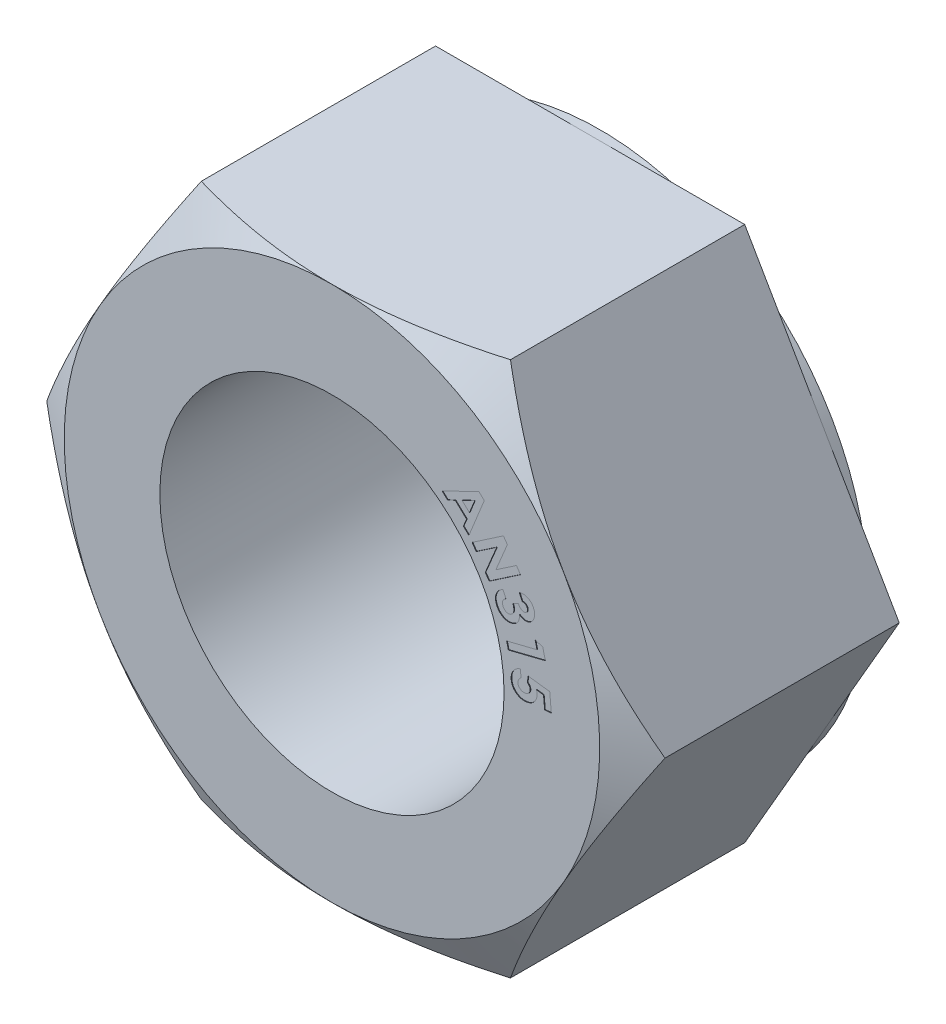
from build123d import *
from build123d.topology import SkipClean

# Parameters (mm, degrees)
SKETCH1_R           = 7.14375
BOSS_EXTRUDE1_DEPTH = 10.715625
SKETCH2_OUTSIDE_W   = 47.158
SKETCH2_OUTSIDE_H   = 43.72
SKETCH2_OUTSIDE_R   = 11.1125
CUT_EXTRUDE1_DEPTH  = 3.571875
CUT_EXTRUDE1_DRAFT  = -60
BOSS_EXTRUDE2_START = 0.4064
SKETCH3_R           = 11.1125
SKETCH3_R_2         = 7.14375
BOSS_EXTRUDE2_DEPTH = 0.4064
CUT_EXTRUDE2_DEPTH  = 0.0254


with BuildPart() as part:
    # Sketch1 → Boss-Extrude1 (new body)
    with BuildSketch(Plane.XY):
        Polygon((6.415804866, 11.1125), (-6.415804866, 11.1125), (-12.831609733, 0), (-6.415804866, -11.1125), (6.415804866, -11.1125), (12.831609733, 0), align=None)
        Circle(SKETCH1_R, mode=Mode.SUBTRACT)
    extrude(amount=BOSS_EXTRUDE1_DEPTH)


with BuildPart() as cut_extrude1_tool:
    # Sketch2 outside → Cut-Extrude1 (with draft: the straight prism first)
    with BuildSketch(Plane.XY.offset(10.715625)):
        Rectangle(SKETCH2_OUTSIDE_W, SKETCH2_OUTSIDE_H)
        Circle(SKETCH2_OUTSIDE_R, mode=Mode.SUBTRACT)
    extrude(amount=-CUT_EXTRUDE1_DEPTH)
    # Cut-Extrude1: the draft: its side faces are tilted about the plane it starts from
    cut_extrude1_sides = [cut_extrude1_tool.faces().sort_by_distance(p)[0] for p in [
        (0, -21.86, 8.9296875),
        (23.579, 0, 8.9296875),
        (0, 21.86, 8.9296875),
        (-23.579, 0, 8.9296875),
        (-11.1125, 0, 8.9296875),
    ]]
    draft(cut_extrude1_sides, Plane.XY.offset(10.715625), CUT_EXTRUDE1_DRAFT)


with BuildPart() as part_1:
    add(part.part)

    # Cut-Extrude1: cut by cut_extrude1_tool
    add(cut_extrude1_tool.part, mode=Mode.SUBTRACT)

    # Sketch3 → Boss-Extrude2 (add)
    with SkipClean():  # the faces are left unmerged after this step: merging them gives an invalid solid
        with BuildSketch(Plane(origin=(0, 0, 0), x_dir=(-1, 0, 0), z_dir=(0, 0, -1)).offset(BOSS_EXTRUDE2_START)):
            Circle(SKETCH3_R)
            Circle(SKETCH3_R_2, mode=Mode.SUBTRACT)
        extrude(amount=-BOSS_EXTRUDE2_DEPTH)

    # Sketch4 → Cut-Extrude2 (cut)
    # profile 1 of 5: a face of its own
    with SkipClean():  # the faces are left unmerged after this step: merging them gives an invalid solid
        with BuildSketch(Plane.XY.offset(10.715625)):
            with BuildLine():
                Line((9.038453282, 0.990915797), (9.105871151, 0.251227296))
                Line((9.105871151, 0.251227296), (8.828885474, 0.225786591))
                Line((8.828885474, 0.225786591), (8.781820169, 0.74096087))
                Line((8.781820169, 0.74096087), (8.488298034, 0.779439936))
                add(Edge.make_bspline(
                    [(8.488298034, 0.779439936), (8.491399544, 0.770788724), (8.497505412, 0.753757294), (8.504191357, 0.728055043), (8.510037954, 0.703214375), (8.511881599, 0.686713923), (8.512784712, 0.678631142)],
                    knots=[0, 0, 0, 0, 1.059698368, 2.086202335, 3.062522125, 4, 4, 4, 4], degree=3))
                add(Edge.make_bspline(
                    [(8.512784712, 0.678631142), (8.514012123, 0.661041097), (8.516422683, 0.62649529), (8.513499882, 0.575374368), (8.506700942, 0.526147598), (8.494918734, 0.478641893), (8.477845057, 0.43315961), (8.456590273, 0.389156371), (8.429846961, 0.347541902), (8.399270921, 0.307781278), (8.36426837, 0.271500572), (8.32648162, 0.238534295), (8.285485591, 0.209949812), (8.241243914, 0.18620183), (8.194364838, 0.166033227), (8.144452599, 0.150068298), (8.091500515, 0.13858384), (8.055005274, 0.134415938), (8.036407509, 0.132291999)],
                    knots=[0, 0, 0, 0, 1.041787241, 2.046008406, 3.021166164, 3.97746446, 4.933454527, 5.889444595, 6.861575472, 7.853394237, 8.850960893, 9.837536107, 10.814807103, 11.799368876, 12.801906058, 13.828801175, 14.893569587, 16, 16, 16, 16], degree=3))
                add(Edge.make_bspline(
                    [(8.036407509, 0.132291999), (8.017547874, 0.131118341), (7.98036187, 0.12880421), (7.925164511, 0.131000549), (7.87180188, 0.138673197), (7.820237245, 0.151471081), (7.770458207, 0.169320764), (7.722500985, 0.192342755), (7.676504506, 0.220641086), (7.632559948, 0.253327047), (7.592370611, 0.290447965), (7.55562871, 0.32978936), (7.524390977, 0.372400719), (7.497972249, 0.417462414), (7.475720767, 0.464839148), (7.458556444, 0.514936342), (7.446397404, 0.567732517), (7.442037004, 0.603952548), (7.439822974, 0.622343582)],
                    knots=[0, 0, 0, 0, 1.054162503, 2.078518009, 3.076689065, 4.058169131, 5.038775065, 6.023157371, 7.021591392, 8.048659839, 9.074637147, 10.071176272, 11.048582306, 12.016578309, 12.98267406, 13.964938398, 14.966679863, 16, 16, 16, 16], degree=3))
                add(Edge.make_bspline(
                    [(7.439822974, 0.622343582), (7.438732469, 0.638871826), (7.43658061, 0.671486512), (7.437589755, 0.719983741), (7.442258775, 0.767008108), (7.450889724, 0.812557489), (7.463428917, 0.856538015), (7.479227312, 0.89930419), (7.499088631, 0.940466093), (7.522534652, 0.979901833), (7.549693818, 1.016866603), (7.579095158, 1.051884443), (7.612273508, 1.083447964), (7.64807298, 1.112337824), (7.686892732, 1.138362892), (7.728772026, 1.161061253), (7.773220834, 1.181765636), (7.804574472, 1.192496162), (7.820479524, 1.197939535)],
                    knots=[0, 0, 0, 0, 1.059531475, 2.090741458, 3.099761619, 4.080197849, 5.052907682, 6.02303628, 6.993852298, 7.973326062, 8.954254897, 9.92613664, 10.895173845, 11.879286914, 12.866946685, 13.880879383, 14.925013941, 16, 16, 16, 16], degree=3))
                Line((7.820479524, 1.197939535), (7.849100317, 0.882474792))
                add(Edge.make_bspline(
                    [(7.849100317, 0.882474792), (7.837889272, 0.875103144), (7.816130753, 0.860796169), (7.78733142, 0.83551008), (7.764066003, 0.807121528), (7.7449852, 0.776907948), (7.731411089, 0.744589115), (7.722362836, 0.711126592), (7.718023757, 0.676503761), (7.719118025, 0.653196448), (7.71967073, 0.641424111)],
                    knots=[0, 0, 0, 0, 1.113311254, 2.160726529, 3.167065378, 4.15133894, 5.117501339, 6.065451714, 7.022875119, 8, 8, 8, 8], degree=3))
                add(Edge.make_bspline(
                    [(7.71967073, 0.641424111), (7.720693976, 0.633238888), (7.722703258, 0.617166086), (7.728115326, 0.593798754), (7.735821276, 0.57163626), (7.745767715, 0.550558973), (7.757714037, 0.530475809), (7.772347058, 0.511986992), (7.788626351, 0.494338107), (7.806869398, 0.477953102), (7.826884888, 0.463337116), (7.848158578, 0.450882829), (7.870610921, 0.441000572), (7.894077448, 0.43338672), (7.918500257, 0.427541816), (7.944092247, 0.424396757), (7.970705583, 0.423876391), (7.988710644, 0.424947676), (7.997928442, 0.425496126)],
                    knots=[0, 0, 0, 0, 1.005792376, 1.975010484, 2.919678592, 3.862575002, 4.813945469, 5.763204514, 6.733112457, 7.740399942, 8.74909744, 9.751559368, 10.741516783, 11.735183179, 12.757710372, 13.800237418, 14.873818355, 16, 16, 16, 16], degree=3))
                add(Edge.make_bspline(
                    [(7.997928442, 0.425496126), (8.006857984, 0.42650535), (8.024408142, 0.428488883), (8.049765968, 0.434073704), (8.073858714, 0.440828966), (8.096245418, 0.450256541), (8.117335791, 0.461402529), (8.137121922, 0.474407095), (8.15535108, 0.489545393), (8.172095101, 0.506240738), (8.18691396, 0.524298589), (8.19982629, 0.54301537), (8.209996679, 0.562769505), (8.218398857, 0.582907585), (8.223986496, 0.603906573), (8.228041201, 0.625355506), (8.22923402, 0.647579816), (8.228312615, 0.662523053), (8.227848815, 0.670044904)],
                    knots=[0, 0, 0, 0, 1.150546408, 2.261288592, 3.322783048, 4.351809269, 5.366394834, 6.375877368, 7.379220387, 8.397163563, 9.400506582, 10.368577705, 11.30409275, 12.242265653, 13.15825545, 14.082663711, 15.034886575, 16, 16, 16, 16], degree=3))
                add(Edge.make_bspline(
                    [(8.227848815, 0.670044904), (8.226770826, 0.678242315), (8.22461547, 0.694632412), (8.21781349, 0.718862891), (8.207478352, 0.742336504), (8.194268531, 0.765393743), (8.178254237, 0.788123409), (8.159090541, 0.810369576), (8.136756562, 0.832105644), (8.12005979, 0.845409691), (8.111457589, 0.852263954)],
                    knots=[0, 0, 0, 0, 0.891095448, 1.781677191, 2.703567528, 3.650988198, 4.643960318, 5.698182252, 6.814100239, 8, 8, 8, 8], degree=3))
                Line((8.111457589, 0.852263954), (8.143894488, 1.101900874))
                Line((8.143894488, 1.101900874), (9.038453282, 0.990915797))
            make_face()
        # profile 2 of 5: a face of its own
        with BuildSketch(Plane.XY.offset(10.715625)):
            Polygon((8.749052213, 2.447438318), (8.858129236, 2.010176198), (7.32310069, 1.627293586), (7.250594681, 1.917635633), (8.51118162, 2.231828342), (8.432315434, 2.547929103), align=None)
        # profile 3 of 5: a face of its own
        with BuildSketch(Plane.XY.offset(10.715625)):
            with BuildLine():
                Line((7.894279169, 3.658348004), (7.77597989, 3.922931338))
                add(Edge.make_bspline(
                    [(7.77597989, 3.922931338), (7.789922862, 3.926842509), (7.817281845, 3.934517034), (7.858437411, 3.942403445), (7.89860458, 3.947272923), (7.937845056, 3.948899274), (7.976147256, 3.947354041), (8.013481961, 3.942540662), (8.049946642, 3.93474717), (8.073382636, 3.926866322), (8.085084457, 3.922931338)],
                    knots=[0, 0, 0, 0, 1.104517984, 2.167291897, 3.193585075, 4.189239569, 5.16065037, 6.114700108, 7.058651245, 8, 8, 8, 8], degree=3))
                add(Edge.make_bspline(
                    [(8.085084457, 3.922931338), (8.100919392, 3.916685665), (8.132253919, 3.904326585), (8.176277537, 3.880251564), (8.216863478, 3.852059299), (8.254365705, 3.820094686), (8.288465601, 3.784046922), (8.319111328, 3.743900944), (8.346782009, 3.699951305), (8.361759839, 3.668167465), (8.369384337, 3.651987828)],
                    knots=[0, 0, 0, 0, 1.010479047, 1.999558852, 2.972550385, 3.941785023, 4.921781917, 5.91430382, 6.938271591, 8, 8, 8, 8], degree=3))
                add(Edge.make_bspline(
                    [(8.369384337, 3.651987828), (8.37559343, 3.637249904), (8.387781928, 3.608319244), (8.40111277, 3.563877007), (8.410036601, 3.519796762), (8.415013634, 3.475942918), (8.415179444, 3.432161638), (8.411502662, 3.388577683), (8.403095476, 3.345217542), (8.390305185, 3.302753305), (8.374507508, 3.261715079), (8.354787759, 3.223660283), (8.332754117, 3.188414919), (8.30692828, 3.156802837), (8.27860933, 3.128022545), (8.247283023, 3.102354873), (8.212597925, 3.080228548), (8.187720865, 3.068195441), (8.175080952, 3.062081478)],
                    knots=[0, 0, 0, 0, 1.11070698, 2.180326386, 3.217572762, 4.232770609, 5.241964487, 6.254995363, 7.267704811, 8.304872716, 9.333530489, 10.31856289, 11.278995576, 12.216586473, 13.148954304, 14.080827334, 15.024877689, 16, 16, 16, 16], degree=3))
                add(Edge.make_bspline(
                    [(8.175080952, 3.062081478), (8.159027947, 3.055624587), (8.127380846, 3.042895391), (8.077157118, 3.032936468), (8.026296918, 3.029926905), (7.974845947, 3.034819542), (7.923637369, 3.047329939), (7.873393384, 3.067672549), (7.824167339, 3.095572439), (7.793822053, 3.11923191), (7.778205952, 3.131407399)],
                    knots=[0, 0, 0, 0, 0.973705091, 1.919574701, 2.871335525, 3.837694989, 4.821907599, 5.832918214, 6.884789897, 8, 8, 8, 8], degree=3))
                add(Edge.make_bspline(
                    [(7.778205952, 3.131407399), (7.779551655, 3.119124202), (7.782202863, 3.094924717), (7.783030123, 3.058890966), (7.7816483, 3.023891973), (7.777013678, 2.98989112), (7.770157037, 2.956890389), (7.760416633, 2.924828127), (7.748542675, 2.893612999), (7.733367631, 2.863801419), (7.716391014, 2.835148924), (7.696862914, 2.80845619), (7.675423297, 2.783321795), (7.651570707, 2.760251777), (7.625730371, 2.738887068), (7.597865771, 2.71925755), (7.567607058, 2.701878263), (7.546339085, 2.691679516), (7.535565227, 2.686513069)],
                    knots=[0, 0, 0, 0, 1.085422566, 2.138422586, 3.164163813, 4.160160848, 5.150391029, 6.122937106, 7.102063528, 8.081057004, 9.058764402, 10.025807609, 10.983654411, 11.958606571, 12.937821614, 13.927613544, 14.950177454, 16, 16, 16, 16], degree=3))
                add(Edge.make_bspline(
                    [(7.535565227, 2.686513069), (7.519465124, 2.679828739), (7.487674585, 2.666630162), (7.438415296, 2.652662141), (7.389072979, 2.644006788), (7.339483551, 2.640739593), (7.289924983, 2.643088795), (7.240140543, 2.650419792), (7.190303192, 2.663323838), (7.140813896, 2.681366144), (7.092662611, 2.704028288), (7.047267661, 2.731531753), (7.005038638, 2.763479744), (6.966176565, 2.800042652), (6.930108035, 2.840519859), (6.897142185, 2.885395139), (6.867513667, 2.934736232), (6.850808771, 2.970024014), (6.842306012, 2.987985424)],
                    knots=[0, 0, 0, 0, 0.99009374, 1.954994565, 2.902855786, 3.83258499, 4.773354951, 5.717379283, 6.68760674, 7.693863004, 8.707128336, 9.707270344, 10.704941606, 11.710873196, 12.735005241, 13.782110249, 14.871098551, 16, 16, 16, 16], degree=3))
                add(Edge.make_bspline(
                    [(6.842306012, 2.987985424), (6.83499483, 3.00525108), (6.820632438, 3.039168459), (6.804869435, 3.091084971), (6.79394342, 3.142363922), (6.78761706, 3.192921857), (6.787211636, 3.242895531), (6.79106404, 3.292183072), (6.800959001, 3.34068473), (6.815034427, 3.388430059), (6.834587256, 3.434476314), (6.858450175, 3.478525525), (6.886915125, 3.520169367), (6.920206036, 3.559041264), (6.958032434, 3.595400558), (7.000174088, 3.62956509), (7.04702153, 3.661147841), (7.080757869, 3.679503605), (7.097985098, 3.688876851)],
                    knots=[0, 0, 0, 0, 1.078980919, 2.119595491, 3.117951532, 4.09530308, 5.047518354, 5.99079152, 6.936411557, 7.892238712, 8.85236279, 9.810991937, 10.772569883, 11.751026149, 12.752437211, 13.789537636, 14.871242606, 16, 16, 16, 16], degree=3))
                Line((7.097985098, 3.688876851), (7.219782474, 3.416343297))
                add(Edge.make_bspline(
                    [(7.219782474, 3.416343297), (7.211437181, 3.410726661), (7.195137307, 3.39975635), (7.172650217, 3.381961295), (7.152411246, 3.363741041), (7.13452081, 3.345031701), (7.119119145, 3.325584285), (7.106429999, 3.305440043), (7.095777623, 3.284953359), (7.084744252, 3.257214002), (7.077294678, 3.220902795), (7.076144965, 3.176241492), (7.084393609, 3.130598219), (7.095874982, 3.101347955), (7.101801204, 3.086250148)],
                    knots=[0, 0, 0, 0, 0.934000059, 1.824271922, 2.660710563, 3.46156985, 4.225764819, 4.960471955, 5.669396526, 6.367783234, 7.727208831, 9.086170893, 10.495998872, 12, 12, 12, 12], degree=3))
                add(Edge.make_bspline(
                    [(7.101801204, 3.086250148), (7.105469335, 3.078433793), (7.112677393, 3.063074269), (7.125861526, 3.041715534), (7.140369509, 3.02225325), (7.156680718, 3.00502943), (7.173620392, 2.988776185), (7.192910722, 2.975298653), (7.213316473, 2.963427676), (7.241958523, 2.950399348), (7.279366776, 2.93942218), (7.325330009, 2.935950793), (7.371424204, 2.941431385), (7.400276591, 2.952663378), (7.415039886, 2.958410605)],
                    knots=[0, 0, 0, 0, 0.822631405, 1.616511524, 2.388671329, 3.132463618, 3.876255907, 4.622310739, 5.369460096, 6.124767832, 7.618553775, 9.0580146, 10.494634147, 12, 12, 12, 12], degree=3))
                add(Edge.make_bspline(
                    [(7.415039886, 2.958410605), (7.422990161, 2.962247649), (7.438653963, 2.969807477), (7.460072542, 2.984332518), (7.479445756, 3.001045646), (7.496519358, 3.02015735), (7.511640656, 3.041331011), (7.524499101, 3.06479693), (7.534747257, 3.090635495), (7.543492276, 3.118408697), (7.54962791, 3.148109356), (7.551905749, 3.179489721), (7.551645232, 3.212266722), (7.548078434, 3.246429537), (7.541227068, 3.282130225), (7.53123401, 3.31913694), (7.518693936, 3.357848212), (7.507785637, 3.383454583), (7.502174301, 3.39662675)],
                    knots=[0, 0, 0, 0, 0.848799441, 1.672322786, 2.482462906, 3.306112664, 4.132853526, 4.982204752, 5.874652412, 6.804129638, 7.78266186, 8.78593771, 9.826751601, 10.93443802, 12.087125054, 13.322136123, 14.62248061, 16, 16, 16, 16], degree=3))
                Line((7.502174301, 3.39662675), (7.73845485, 3.502205677))
                add(Edge.make_bspline(
                    [(7.73845485, 3.502205677), (7.746848844, 3.487251446), (7.762540401, 3.459296321), (7.787289765, 3.421890789), (7.811094867, 3.391649793), (7.834282596, 3.367888866), (7.858070894, 3.350301827), (7.881963676, 3.336329051), (7.907094705, 3.326453362), (7.932748091, 3.320018866), (7.958473687, 3.317512052), (7.983592415, 3.318492808), (8.007987811, 3.322625552), (8.023156502, 3.328720101), (8.03070495, 3.331752952)],
                    knots=[0, 0, 0, 0, 1.642709423, 3.07084639, 4.292175591, 5.326319723, 6.240382634, 7.11841419, 7.970874321, 8.818237122, 9.644896352, 10.43766993, 11.222532245, 12, 12, 12, 12], degree=3))
                add(Edge.make_bspline(
                    [(8.03070495, 3.331752952), (8.039933687, 3.336487971), (8.058011955, 3.345763448), (8.080965123, 3.365438865), (8.098526937, 3.389513916), (8.111280779, 3.416799021), (8.118198211, 3.44679869), (8.119255722, 3.478379616), (8.113292917, 3.51088203), (8.104965277, 3.531797226), (8.100666889, 3.542592796)],
                    knots=[0, 0, 0, 0, 0.9980056, 1.9550034, 2.883338229, 3.853030733, 4.840031001, 5.832206865, 6.881073733, 8, 8, 8, 8], degree=3))
                add(Edge.make_bspline(
                    [(8.100666889, 3.542592796), (8.095864906, 3.552087657), (8.08641589, 3.570770998), (8.067270003, 3.595875311), (8.043639028, 3.616783926), (8.017065475, 3.634595944), (7.988032618, 3.648242922), (7.957538967, 3.656914693), (7.926031886, 3.660626037), (7.904985479, 3.659116106), (7.894279169, 3.658348004)],
                    knots=[0, 0, 0, 0, 1.007904216, 1.983285146, 2.972815819, 3.987916587, 5.009025242, 6.002074575, 6.983655023, 8, 8, 8, 8], degree=3))
            make_face()
        # profile 4 of 5: a face of its own
        with BuildSketch(Plane.XY.offset(10.715625)):
            Polygon((7.118260458, 5.628578038), (7.279490927, 5.391661471), (6.802477706, 4.251917881), (7.658557433, 4.833556002), (7.826784096, 4.585827136), (6.525810038, 3.701762633), (6.36426156, 3.939633226), (6.839366728, 5.076832745), (5.985831071, 4.496784668), (5.8172864, 4.744513534), align=None)
        # profile 5 of 5: a face of its own
        with BuildSketch(Plane.XY.offset(10.715625)):
            Polygon((6.099955523, 6.707900777), (6.322879702, 6.498650977), (5.682727959, 4.9264154), (5.45439763, 5.140753341), (5.587325315, 5.463532287), (5.116354261, 5.905564539), (4.798663456, 5.756418405), (4.570333127, 5.970756346), align=None)
            Polygon((5.925368684, 6.295761354), (5.399064097, 6.043580364), (5.706260611, 5.75514637), align=None, mode=Mode.SUBTRACT)
        extrude(amount=-CUT_EXTRUDE2_DEPTH, mode=Mode.SUBTRACT)


solid = part_1.part
